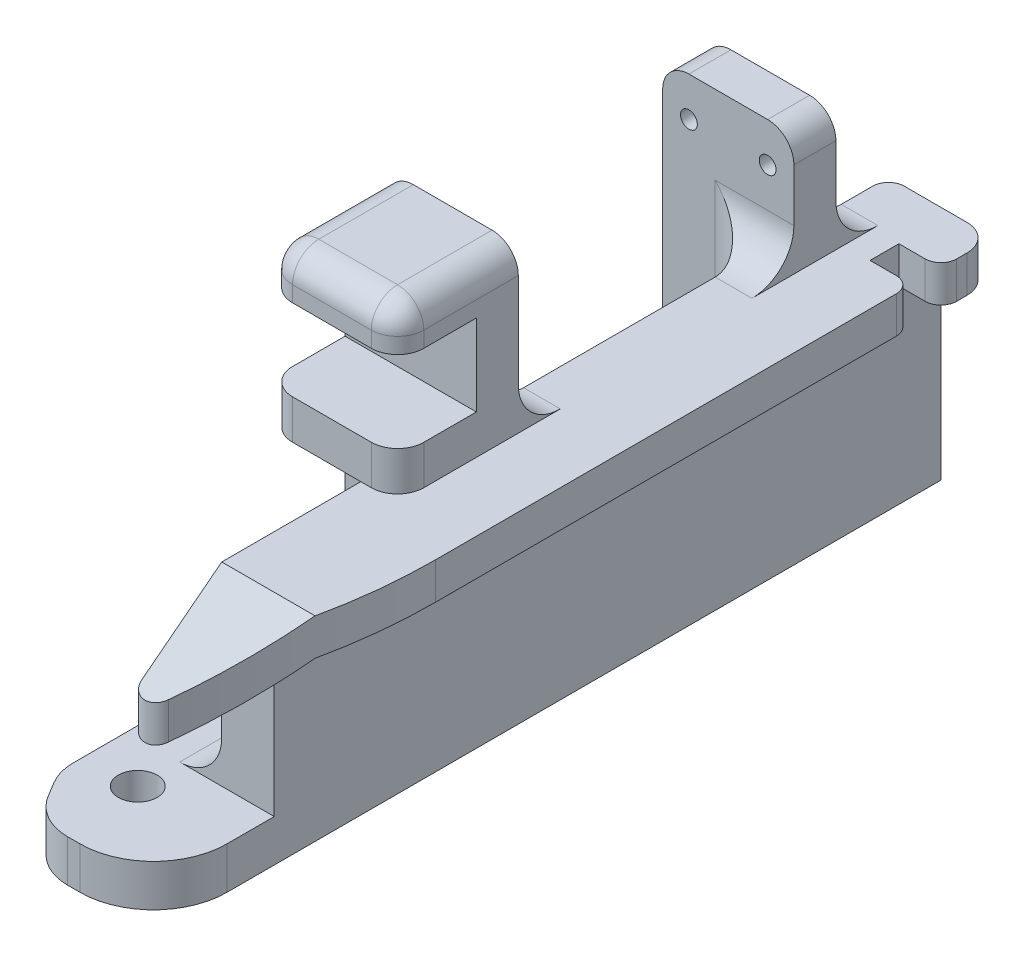
from build123d import *

# Parameters (mm, degrees)
SKETCH1_R           = 3.7
BOSS_EXTRUDE1_DEPTH = 8
FILLET1_R           = 10
SKETCH2_W           = 10
SKETCH2_H           = 127
BOSS_EXTRUDE2_DEPTH = 30
BOSS_EXTRUDE3_DEPTH = 7
FILLET2_R           = 3
SKETCH4_W           = 18
SKETCH4_H           = 8
BOSS_EXTRUDE4_DEPTH = 27
SKETCH5_W           = 25
SKETCH5_H           = 8
BOSS_EXTRUDE5_DEPTH = 33
SKETCH6_W           = 25
SKETCH6_H           = 23.005701243
BOSS_EXTRUDE6_DEPTH = 8
SKETCH7_W           = 25
SKETCH7_H           = 7.5
BOSS_EXTRUDE7_DEPTH = 15
CUT_EXTRUDE1_REACH  = 159.817
SKETCH8_R           = 1.6
FILLET3_R           = 8
FILLET4_R           = 5
CUT_EXTRUDE2_REACH  = 163.149
SKETCH9_W           = 8
SKETCH9_H           = 5.5
FILLET7_R           = 3
BOSS_EXTRUDE8_DEPTH = 10
CUT_EXTRUDE3_START  = -17.777833
CUT_EXTRUDE3_DEPTH  = 17.777833


with BuildPart() as part:
    # Sketch1 → Boss-Extrude1 (new body)
    with BuildSketch(Plane(origin=(0, 0, 0), x_dir=(1, 0, 0), z_dir=(0, 1, 0))):
        with BuildLine():
            Line((0, 0), (0, -140))
            Line((0, -140), (6, -150))
            Line((6, -150), (13.995477091, -150))
            ThreePointArc((13.995477091, -150), (23.898170207, -145.898170207), (28, -135.995477091))
            Line((28, -135.995477091), (28, 0))
            Line((28, 0), (0, 0))
        make_face()
        with Locations(Location((10, -135, 0), (0, 0, 270))):
            Circle(SKETCH1_R, mode=Mode.SUBTRACT)
    extrude(amount=BOSS_EXTRUDE1_DEPTH)

    # Fillet1
    fillet1_edges = [part.edges().sort_by_distance(p)[0] for p in [
        (6, 4, 150),
        (0, 4, 140),
    ]]
    fillet(fillet1_edges, radius=FILLET1_R)

    # Sketch2 → Boss-Extrude2 (add)
    with BuildSketch(Plane(origin=(0, 8, 0), x_dir=(1, 0, 0), z_dir=(0, 1, 0))):
        with Locations((23, -63.5)):
            Rectangle(SKETCH2_W, SKETCH2_H)
    extrude(amount=BOSS_EXTRUDE2_DEPTH)

    # Sketch3 → Boss-Extrude3 (add)
    with BuildSketch(Plane(origin=(0, 38, 0), x_dir=(1, 0, 0), z_dir=(0, 1, 0))):
        with BuildLine():
            Line((18, 0), (38, 0))
            Line((38, 0), (38, -106.265006005))
            ThreePointArc((38, -106.265006005), (34.694156342, -131.484540297), (25, -155))
            Line((25, -155), (18, -127))
            Line((18, -127), (18, 0))
        make_face()
    extrude(amount=BOSS_EXTRUDE3_DEPTH)

    # Fillet2
    fillet2_edges = [part.edges().sort_by_distance(p)[0] for p in [
        (0, 4, 0),
        (18, 26.5, 0),
        (25, 41.5, 155),
    ]]
    fillet(fillet2_edges, radius=FILLET2_R)

    # Sketch4 → Boss-Extrude4 (add)
    with BuildSketch(Plane(origin=(0, 8, 0), x_dir=(1, 0, 0), z_dir=(0, 1, 0))):
        with Locations((9, -21.010298757)):
            Rectangle(SKETCH4_W, SKETCH4_H)
        with Locations((9, -81.507298757)):
            Rectangle(SKETCH4_W, SKETCH4_H)
    extrude(amount=BOSS_EXTRUDE4_DEPTH)

    # Sketch5 → Boss-Extrude5 (add)
    with BuildSketch(Plane(origin=(0, 35, 0), x_dir=(1, 0, 0), z_dir=(0, 1, 0))):
        with Locations((12.5, -21.010298757)):
            Rectangle(SKETCH5_W, SKETCH5_H)
        with Locations((12.5, -81.507298757)):
            Rectangle(SKETCH5_W, SKETCH5_H)
    extrude(amount=BOSS_EXTRUDE5_DEPTH)

    # Sketch6 → Boss-Extrude6 (add)
    with BuildSketch(Plane(origin=(0, 68, 0), x_dir=(1, 0, 0), z_dir=(0, 1, 0))):
        with Locations((12.5, -89.010149379)):
            Rectangle(SKETCH6_W, SKETCH6_H)
    extrude(amount=BOSS_EXTRUDE6_DEPTH)

    # Sketch7 → Boss-Extrude7 (add)
    with BuildSketch(Plane.XY.offset(85.507298757)):
        with Locations((12.5, 48.75)):
            Rectangle(SKETCH7_W, SKETCH7_H)
    extrude(amount=BOSS_EXTRUDE7_DEPTH)

    # Sketch8 → Cut-Extrude1 (cut, up to next)
    with BuildSketch(Plane(origin=(0, 0, 17.010298757), x_dir=(-1, 0, 0), z_dir=(0, 0, -1)), mode=Mode.PRIVATE) as cut_extrude1_sk1:
        with Locations((-20, 60.5)):
            Circle(SKETCH8_R)
    cut_extrude1_tool1 = extrude(cut_extrude1_sk1.sketch, amount=-CUT_EXTRUDE1_REACH, mode=Mode.PRIVATE) & part.part
    # Sketch8 → Cut-Extrude1 (cut, up to next)
    with BuildSketch(Plane(origin=(0, 0, 17.010298757), x_dir=(-1, 0, 0), z_dir=(0, 0, -1)), mode=Mode.PRIVATE) as cut_extrude1_sk2:
        with Locations((-5, 60.5)):
            Circle(SKETCH8_R)
    cut_extrude1_tool2 = extrude(cut_extrude1_sk2.sketch, amount=-CUT_EXTRUDE1_REACH, mode=Mode.PRIVATE) & part.part
    add(cut_extrude1_tool1.solids().sort_by_distance((20, 60.5, 17.010299))[0], mode=Mode.SUBTRACT)
    add(cut_extrude1_tool2.solids().sort_by_distance((5, 60.5, 17.010299))[0], mode=Mode.SUBTRACT)

    # Fillet3
    fillet3_edges = [part.edges().sort_by_distance(p)[0] for p in [
        (18.878679656, 8, 0.878679656),
        (18, 8, 10.005149379),
    ]]
    fillet(fillet3_edges, radius=FILLET3_R)
    fillet3_2_edges = [part.edges().sort_by_distance(p)[0] for p in [
        (5, 8, 17.010298757),
    ]]
    fillet(fillet3_2_edges, radius=FILLET3_R)
    fillet3_3_edges = [part.edges().sort_by_distance(p)[0] for p in [
        (21.5, 45, 17.010298757),
    ]]
    fillet(fillet3_3_edges, radius=FILLET3_R)
    fillet3_4_edges = [part.edges().sort_by_distance(p)[0] for p in [
        (18, 26.5, 25.010298757),
    ]]
    fillet(fillet3_4_edges, radius=FILLET3_R)
    fillet3_5_edges = [part.edges().sort_by_distance(p)[0] for p in [
        (5, 8, 25.010298757),
    ]]
    fillet(fillet3_5_edges, radius=FILLET3_R)
    fillet3_6_edges = [part.edges().sort_by_distance(p)[0] for p in [
        (21.5, 45, 25.010298757),
    ]]
    fillet(fillet3_6_edges, radius=FILLET3_R)
    fillet3_7_edges = [part.edges().sort_by_distance(p)[0] for p in [
        (5, 8, 77.507298757),
    ]]
    fillet(fillet3_7_edges, radius=FILLET3_R)
    fillet3_8_edges = [part.edges().sort_by_distance(p)[0] for p in [
        (21.5, 45, 77.507298757),
    ]]
    fillet(fillet3_8_edges, radius=FILLET3_R)
    fillet3_9_edges = [part.edges().sort_by_distance(p)[0] for p in [
        (9, 8, 85.507298757),
    ]]
    fillet(fillet3_9_edges, radius=FILLET3_R)
    fillet3_10_edges = [part.edges().sort_by_distance(p)[0] for p in [
        (18, 30.5, 85.507298757),
    ]]
    fillet(fillet3_10_edges, radius=FILLET3_R)

    # Fillet4
    fillet4_edges = [part.edges().sort_by_distance(p)[0] for p in [
        (38, 41.5, 0),
        (25, 68, 21.010298757),
        (25, 76, 89.010149379),
        (0, 76, 89.010149379),
        (0, 68, 21.010298757),
        (12.5, 76, 100.513),
        (25, 72, 100.513),
        (0, 72, 100.513),
        (25, 48.75, 100.507298757),
        (0, 48.75, 100.507298757),
    ]]
    fillet(fillet4_edges, radius=FILLET4_R)

    # Sketch9 → Cut-Extrude2 (cut, up to next)
    with BuildSketch(Plane(origin=(0, 45, 0), x_dir=(1, 0, 0), z_dir=(0, 1, 0)), mode=Mode.PRIVATE) as cut_extrude2_sk1:
        with Locations((34, -12.754149379)):
            Rectangle(SKETCH9_W, SKETCH9_H)
    cut_extrude2_tool1 = extrude(cut_extrude2_sk1.sketch, amount=-CUT_EXTRUDE2_REACH, mode=Mode.PRIVATE) & part.part
    add(cut_extrude2_tool1.solids().sort_by_distance((34, 45, 12.754149))[0], mode=Mode.SUBTRACT)

    # Fillet7
    fillet7_edges = [part.edges().sort_by_distance(p)[0] for p in [
        (38, 41.5, 10.004149379),
        (38, 41.5, 15.504149379),
    ]]
    fillet(fillet7_edges, radius=FILLET7_R)

    # Sketch10 → Boss-Extrude8 (add)
    with BuildSketch(Plane.XZ.offset(-38)):
        with BuildLine():
            Line((18, 127), (28, 127))
            Line((28, 127), (35.777833095, 127))
            ThreePointArc((35.777833095, 127), (32.833324538, 137.640533241), (28.708897726, 147.881635807))
            ThreePointArc((28.708897726, 147.881635807), (25.702724236, 149.591554326), (23.08332777, 147.333311082))
            Line((23.08332777, 147.333311082), (18, 127))
        make_face()
    extrude(amount=BOSS_EXTRUDE8_DEPTH)

    # Sketch11 → Cut-Extrude3 (cut)
    with BuildSketch(Plane.ZY.offset(-18).offset(CUT_EXTRUDE3_START)):
        Polygon((127, 28), (127, 38), (149.605704206, 30.5), (149.605704206, 28), align=None)
        Polygon((149.605704206, 45), (149.605704206, 37.5), (127, 45), align=None)
    extrude(amount=CUT_EXTRUDE3_DEPTH, mode=Mode.SUBTRACT)


solid = part.part
